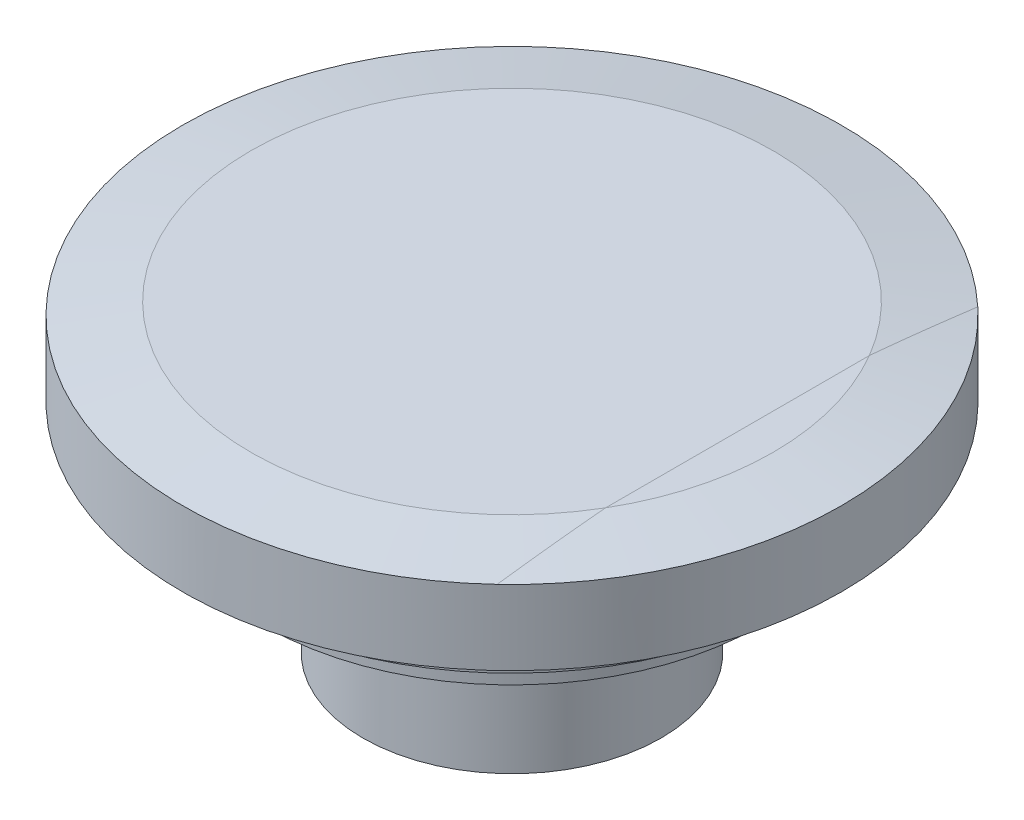
from build123d import *

# Parameters (mm, degrees)
CUT_EXTRUDE1_DEPTH        = 30.53070436
CUT_EXTRUDE1_DEPTH_BACK   = 5
FILLET1_R                 = 1
SKETCH3_R                 = 8.6
BOSS_EXTRUDE1_DEPTH       = 10.25
SKETCH3_3_R               = 3
CUT_EXTRUDE2_DEPTH        = 5
BOSS_EXTRUDE2_OUTLINE_R   = 7.4
BOSS_EXTRUDE2_OUTLINE_R_2 = 6.8
BOSS_EXTRUDE2_DEPTH       = 10.25


# Read off the part's stored shape, not the designer's step: Shell3, Boss-Extrude2, Intersect1
with BuildPart() as part:
    # Sketch1 → Revolve1 (revolve)
    with BuildSketch(Plane.XY, mode=Mode.PRIVATE) as revolve1_sk:
        Polygon((-15.060768988, 10.676328976), (-19, 9.981736265), (-19, 5.676328976), (-16.35, 5.676328976), (-16.35, 3.676328976), (-14.35, 3.676328976), (-14.35, 1.676328976), (-12.35, 1.676328976), (-12.35, 0.676328976), (-10.35, 0.676328976), (-10.35, -0.323671024), (-8.6, -0.323671024), (-8.6, -6.823671024), (-5.6, -6.823671024), (-5.6, 3.426328976), (-3, 3.426328976), (-3, -1.573671024), (0, -1.573671024), (0, 10.676328976), align=None)
    revolve(revolve1_sk.sketch.rotate(Axis((0, -1.573671024, 0), (0, 1, 0)), 180), axis=Axis((0, -1.573671024, 0), (0, 1, 0)))

    # Sketch2 → Cut-Extrude1 (cut, two sides: drawn at the far end of the back side and taken through both)
    with BuildSketch(Plane.XZ.offset(1.573671024).offset(-CUT_EXTRUDE1_DEPTH_BACK)):
        Polygon((-5.85, 1.85), (-6.6, 1.1), (-6.6, -1.1), (-5.85, -1.85), (-0.35, -1.85), (0.4, -1.1), (0.4, 1.1), (-0.35, 1.85), align=None)
    extrude(amount=CUT_EXTRUDE1_DEPTH + CUT_EXTRUDE1_DEPTH_BACK, mode=Mode.SUBTRACT)

    # Fillet1
    fillet1_edges = [part.edges().sort_by_distance(p)[0] for p in [
        (-12.35, 1.676328976, 0),
        (-14.35, 3.676328976, 0),
        (-16.35, 5.676328976, 0),
        (-10.35, 0.676328976, 0),
    ]]
    fillet(fillet1_edges, radius=FILLET1_R - 0.0001)  # a hair under: the kernel refuses the full size


with BuildPart() as body_2:
    # Split1: the piece on the far side of the plane
    add(part.part)
    split(bisect_by=Plane(origin=(0, 9.476328976, 0), x_dir=(1, 0, 0), z_dir=(0, 1, 0)), keep=Keep.BOTTOM)

    # Sketch3 → Boss-Extrude1 (add)
    # profile 1 of 2: a face of its own
    with BuildSketch(Plane.XZ.offset(-3.426328976)):
        Circle(SKETCH3_R)
        with BuildLine():
            ThreePointArc((-5.285593628, -1.85), (5.6, 0), (-5.285593628, 1.85))
            Line((-5.285593628, 1.85), (-5.85, 1.85))
            Line((-5.85, 1.85), (-6.6, 1.1))
            Line((-6.6, 1.1), (-6.6, -1.1))
            Line((-6.6, -1.1), (-5.85, -1.85))
            Line((-5.85, -1.85), (-5.285593628, -1.85))
        make_face(mode=Mode.SUBTRACT)
    # profile 2 of 2: a face of its own
    with BuildSketch(Plane.XZ.offset(-3.426328976)):
        with BuildLine():
            ThreePointArc((-5.285593628, -1.85), (-5.6, 0), (-5.285593628, 1.85))
            Line((-5.285593628, 1.85), (-5.85, 1.85))
            Line((-5.85, 1.85), (-6.6, 1.1))
            Line((-6.6, 1.1), (-6.6, -1.1))
            Line((-6.6, -1.1), (-5.85, -1.85))
            Line((-5.85, -1.85), (-5.285593628, -1.85))
        make_face()
    extrude(amount=BOSS_EXTRUDE1_DEPTH)

    # Sketch3<3> → Cut-Extrude2 (cut)
    with BuildSketch(Plane.XZ.offset(-3.426328976)):
        Circle(SKETCH3_3_R)
    extrude(amount=CUT_EXTRUDE2_DEPTH, mode=Mode.SUBTRACT)

    # Shell3 outline → Shell3 (revolve, cut)
    with BuildSketch(Plane.XY):
        with BuildLine():
            ThreePointArc((15.158362471, 4.867966504), (15.86366265, 6.298303477), (17.35, 6.876328976))
            Line((17.35, 6.876328976), (17.8, 6.876328976))
            Line((17.8, 6.876328976), (17.8, 9.476328976))
            Line((17.8, 9.476328976), (0, 9.476328976))
            Line((0, 9.476328976), (0, 4.626328976))
            Line((0, 4.626328976), (6.8, 4.626328976))
            Line((6.8, 4.626328976), (6.8, -5.623671024))
            Line((6.8, -5.623671024), (7.4, -5.623671024))
            Line((7.4, -5.623671024), (7.4, 0.876328976))
            Line((7.4, 0.876328976), (9.506091109, 0.876328976))
            ThreePointArc((9.506091109, 0.876328976), (10.301191152, 1.610236936), (11.35, 1.876328976))
            Line((11.35, 1.876328976), (11.506091109, 1.876328976))
            ThreePointArc((11.506091109, 1.876328976), (12.217878737, 2.562675032), (13.158362471, 2.867966504))
            ThreePointArc((13.158362471, 2.867966504), (13.794365081, 4.231963894), (15.158362471, 4.867966504))
        make_face()
    revolve(axis=Axis((0, 0, 0), (0, 1, 0)), mode=Mode.SUBTRACT)

    # Boss-Extrude2 outline → Boss-Extrude2 (add)
    with BuildSketch(Plane(origin=(0, -5.623671024, 0), x_dir=(1, 0, 0), z_dir=(0, 1, 0))):
        Circle(BOSS_EXTRUDE2_OUTLINE_R)
        Circle(BOSS_EXTRUDE2_OUTLINE_R_2, mode=Mode.SUBTRACT)
    extrude(amount=BOSS_EXTRUDE2_DEPTH)


with BuildPart() as part_1:
    add(part.part)

    # Split1
    split(bisect_by=Plane(origin=(0, 9.476328976, 0), x_dir=(1, 0, 0), z_dir=(0, 1, 0)), keep=Keep.TOP)

    # Combine1: union body 2
    add(body_2.part)


with BuildPart() as body_3:
    # Intersect1 outline → Intersect1 (revolve)
    with BuildSketch(Plane.XY):
        with BuildLine():
            Line((17.8, 6.876328976), (17.8, 9.476328976))
            Line((17.8, 9.476328976), (0, 9.476328976))
            Line((0, 9.476328976), (0, 4.626328976))
            Line((0, 4.626328976), (7.4, 4.626328976))
            Line((7.4, 4.626328976), (7.4, 0.876328976))
            Line((7.4, 0.876328976), (9.506091109, 0.876328976))
            ThreePointArc((9.506091109, 0.876328976), (10.301191152, 1.610236936), (11.35, 1.876328976))
            Line((11.35, 1.876328976), (11.506091109, 1.876328976))
            ThreePointArc((11.506091109, 1.876328976), (12.217878737, 2.562675032), (13.158362471, 2.867966504))
            ThreePointArc((13.158362471, 2.867966504), (13.794365081, 4.231963894), (15.158362471, 4.867966504))
            ThreePointArc((15.158362471, 4.867966504), (15.86366265, 6.298303477), (17.35, 6.876328976))
            Line((17.35, 6.876328976), (17.8, 6.876328976))
        make_face()
    revolve(axis=Axis((0, 0, 0), (0, 1, 0)))


solid = Compound([part_1.part, body_3.part])
